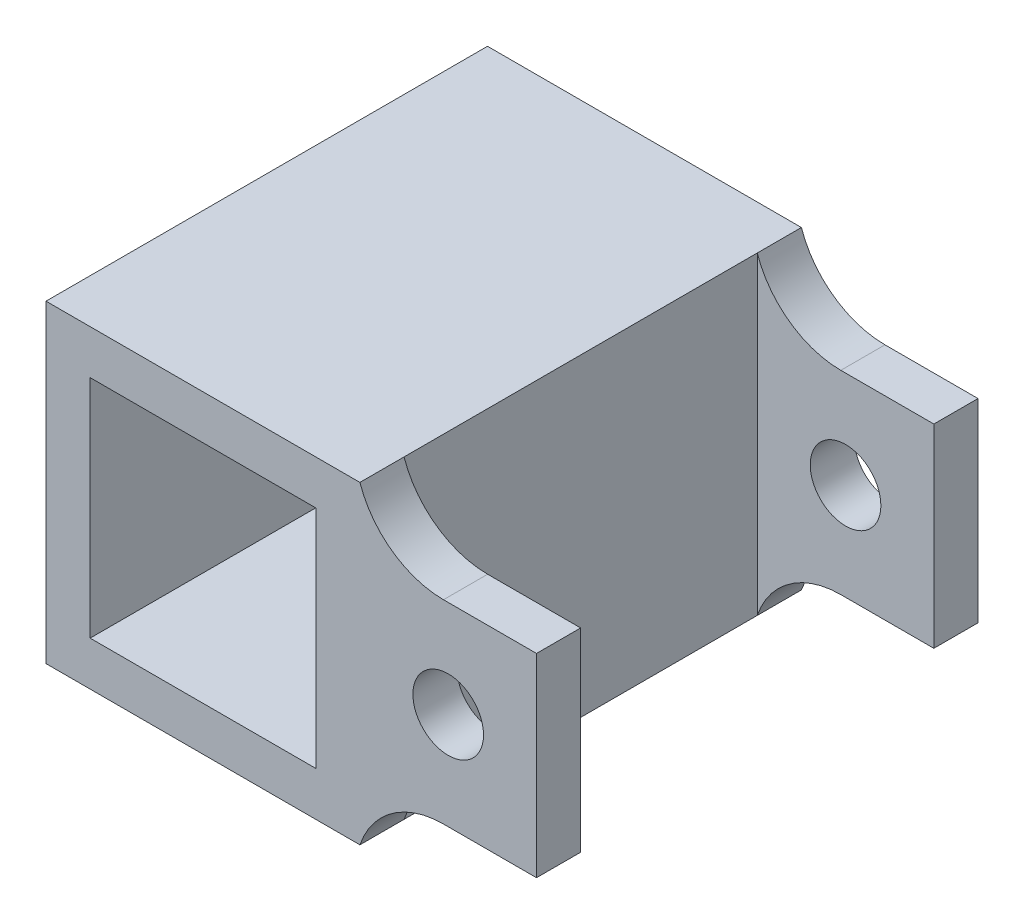
from build123d import *

# Parameters (mm, degrees)
SKETCH1_W            = 35.55
SKETCH1_H            = 35.55
SKETCH1_W_2          = 25.55
SKETCH1_H_2          = 25.55
BOSS_EXTRUDE1_DEPTH  = 25
SKETCH2_R            = 1.25
CUT_EXTRUDE1_DEPTH   = 4
SKETCH3_W            = 20
SKETCH3_H            = 22
SKETCH3_R            = 4
BOSS_EXTRUDE2_DEPTH  = 5
FILLET1_R            = 10
FILLET1_OF_MIRROR2_R = 10


with BuildPart() as part:
    # Sketch1 → Boss-Extrude1 (new, symmetric)
    with BuildSketch(Plane.XY):
        Rectangle(SKETCH1_W, SKETCH1_H)
        Rectangle(SKETCH1_W_2, SKETCH1_H_2, mode=Mode.SUBTRACT)
    extrude(amount=BOSS_EXTRUDE1_DEPTH, both=True)

    # Sketch2 → Cut-Extrude1 (cut, symmetric)
    with BuildSketch(Plane.ZY.offset(17.775)):
        with Locations((-15.6, -14.775)):
            Circle(SKETCH2_R)
        with Locations((15.6, -14.775)):
            Circle(SKETCH2_R)
        with Locations((-15.6, -8.375)):
            Circle(SKETCH2_R)
        with Locations((15.6, -8.375)):
            Circle(SKETCH2_R)
        with Locations((-15.6, -1.975)):
            Circle(SKETCH2_R)
        with Locations((15.6, -1.975)):
            Circle(SKETCH2_R)
        with Locations((-15.6, 4.425)):
            Circle(SKETCH2_R)
        with Locations((15.6, 4.425)):
            Circle(SKETCH2_R)
        with Locations((-15.6, 10.825)):
            Circle(SKETCH2_R)
        with Locations((15.6, 10.825)):
            Circle(SKETCH2_R)
    extrude(amount=CUT_EXTRUDE1_DEPTH, both=True, mode=Mode.SUBTRACT)

    # Sketch3 → Boss-Extrude2 (add)
    with BuildSketch(Plane.XY.offset(25)):
        with Locations((27.775, 0)):
            Rectangle(SKETCH3_W, SKETCH3_H)
        with Locations((27.775, 0)):
            Circle(SKETCH3_R, mode=Mode.SUBTRACT)
    boss_extrude2 = extrude(amount=-BOSS_EXTRUDE2_DEPTH)

    # Fillet1
    # the kernel refuses this fillet: 10 mm, written as the material it adds along each edge
    with BuildSketch(Plane(origin=(17.775, -11, 25), x_dir=(0, -1, 0), z_dir=(0, 0, -1))) as fillet1_piece_1:
        with BuildLine():
            CenterArc((10, -9.465694639), FILLET1_R, 108.814181852, 71.185818148)
            Line((0, -9.465694639), (-0.2, -9.465694639))
            Line((-0.2, -9.465694639), (-0.2, 0))
            Line((-0.2, 0), (0, 0.2))
            ThreePointArc((0, 0.2), (3.3875, 0.2), (6.7105, 0.189313893))
            Line((6.7105, 0.189313893), (6.775, 0))
        make_face()
    extrude(amount=5)
    with BuildSketch(Plane(origin=(17.775, 11, 25), x_dir=(0, 1, 0), z_dir=(0, 0, -1))) as fillet1_piece_2:
        with BuildLine():
            CenterArc((10, 9.465694639), FILLET1_R, 180, 71.185818148)
            Line((0, 9.465694639), (-0.2, 9.465694639))
            Line((-0.2, 9.465694639), (-0.2, 0))
            Line((-0.2, 0), (0, -0.2))
            ThreePointArc((0, -0.2), (3.3875, -0.2), (6.7105, -0.189313893))
            Line((6.7105, -0.189313893), (6.775, 0))
        make_face()
    extrude(amount=5)

    # Mirror2: Boss-Extrude2 across plane
    add(boss_extrude2.mirror(Plane.XY))

    # Fillet1 of Mirror2
    # the kernel refuses this fillet: 10 mm, written as the material it adds along each edge
    with BuildSketch(Plane(origin=(17.775, -11, -25), x_dir=(0, -1, 0), z_dir=(0, 0, 1))) as fillet1_of_mirror2_piece_1:
        with BuildLine():
            CenterArc((10, 9.465694639), FILLET1_OF_MIRROR2_R, 180, 71.185818148)
            Line((0, 9.465694639), (-0.2, 9.465694639))
            Line((-0.2, 9.465694639), (-0.2, 0))
            Line((-0.2, 0), (0, -0.2))
            ThreePointArc((0, -0.2), (3.3875, -0.2), (6.7105, -0.189313893))
            Line((6.7105, -0.189313893), (6.775, 0))
        make_face()
    extrude(amount=5)
    with BuildSketch(Plane(origin=(17.775, 11, -25), x_dir=(0, 1, 0), z_dir=(0, 0, 1))) as fillet1_of_mirror2_piece_2:
        with BuildLine():
            CenterArc((10, -9.465694639), FILLET1_OF_MIRROR2_R, 108.814181852, 71.185818148)
            Line((0, -9.465694639), (-0.2, -9.465694639))
            Line((-0.2, -9.465694639), (-0.2, 0))
            Line((-0.2, 0), (0, 0.2))
            ThreePointArc((0, 0.2), (3.3875, 0.2), (6.7105, 0.189313893))
            Line((6.7105, 0.189313893), (6.775, 0))
        make_face()
    extrude(amount=5)


solid = part.part
